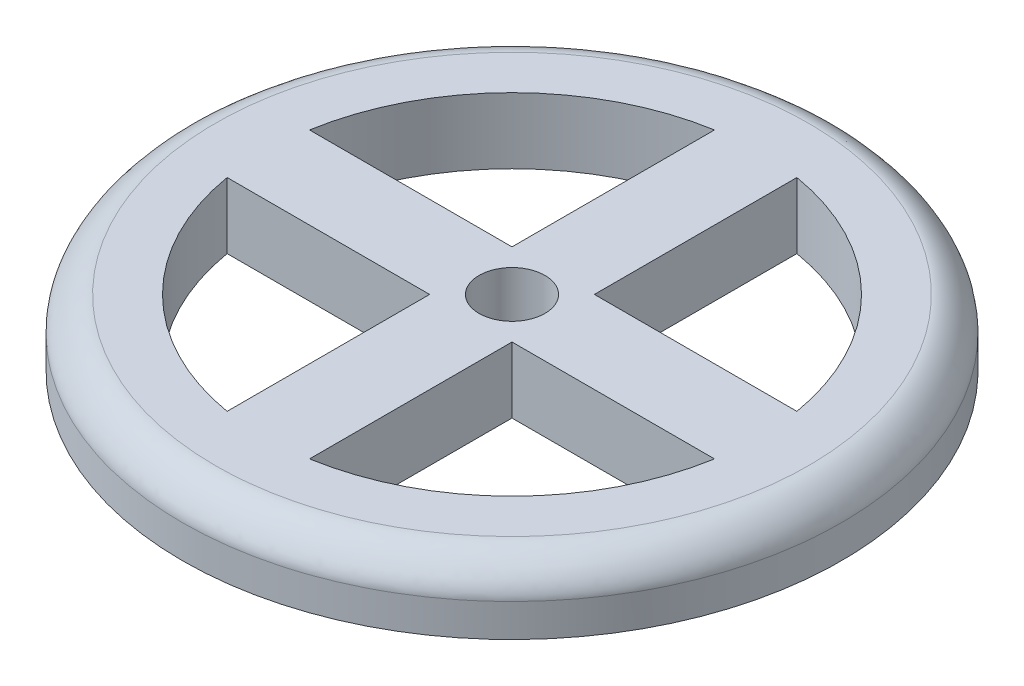
from build123d import *

# Parameters (mm, degrees)
SKETCH2_R           = 20
SKETCH2_R_2         = 2
BOSS_EXTRUDE1_DEPTH = 4
FILLET2_SIZE        = 2


with BuildPart() as part:
    # Sketch2 → Boss-Extrude1 (new body)
    with BuildSketch(Plane(origin=(0, 0, 0), x_dir=(1, 0, 0), z_dir=(0, 1, 0))):
        with Locations(Location((0, 0, 0), (0, 0, 270))):
            Circle(SKETCH2_R)
        with BuildLine():
            Line((-2.5, 14.790199458), (-2.5, 2.5))
            Line((-2.5, 2.5), (-14.790199458, 2.5))
            ThreePointArc((-14.790199458, 2.5), (-10.606601718, 10.606601718), (-2.5, 14.790199458))
        make_face(mode=Mode.SUBTRACT)
        with BuildLine():
            Line((-14.790199458, -2.5), (-2.5, -2.5))
            Line((-2.5, -2.5), (-2.5, -14.790199458))
            ThreePointArc((-2.5, -14.790199458), (-10.606601718, -10.606601718), (-14.790199458, -2.5))
        make_face(mode=Mode.SUBTRACT)
        with BuildLine():
            Line((2.5, -14.790199458), (2.5, -2.5))
            Line((2.5, -2.5), (14.790199458, -2.5))
            ThreePointArc((14.790199458, -2.5), (10.606601718, -10.606601718), (2.5, -14.790199458))
        make_face(mode=Mode.SUBTRACT)
        with BuildLine():
            Line((14.790199458, 2.5), (2.5, 2.5))
            Line((2.5, 2.5), (2.5, 14.790199458))
            ThreePointArc((2.5, 14.790199458), (10.606601718, 10.606601718), (14.790199458, 2.5))
        make_face(mode=Mode.SUBTRACT)
        with Locations(Location((0, 0, 0), (0, 0, 270))):
            Circle(SKETCH2_R_2, mode=Mode.SUBTRACT)
    extrude(amount=BOSS_EXTRUDE1_DEPTH)

    # Fillet2
    # a fillet whose section is not a circle: 2 mm, written as the material it takes off along each edge
    with BuildSketch(Plane(origin=(0, 4, 0), x_dir=(0, 0, 1), z_dir=(-1, 0, 0))) as fillet2_piece_1:
        with BuildLine():
            Bezier((20, -FILLET2_SIZE), (20, 0), (20 - FILLET2_SIZE, 0), weights=[1, 0.471404521, 1])
            Line((20 - FILLET2_SIZE, 0), (20, 0))
            Line((20, 0), (20, -FILLET2_SIZE))
        make_face()
    revolve(axis=Axis((0, 4, 0), (0, 1, 0)), mode=Mode.SUBTRACT)


solid = part.part
